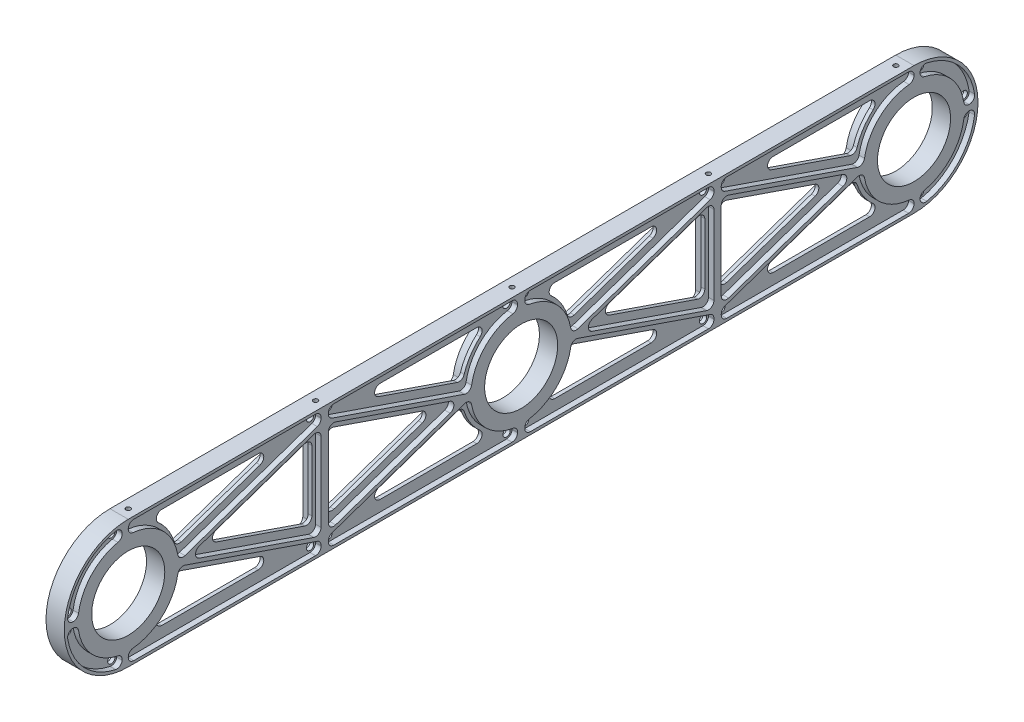
from build123d import *
from build123d.topology import SkipClean

# Parameters (mm, degrees)
SKETCH1_R                       = 35
BOSS_EXTRUDE1_DEPTH             = 10
SKETCH2_R                       = 20
CUT_EXTRUDE1_DEPTH              = 10
CUT_EXTRUDE2_DEPTH              = 10
CUT_EXTRUDE3_DEPTH              = 5
BOSS_EXTRUDE2_DEPTH             = 6
CUT_EXTRUDE4_START              = -3
CUT_EXTRUDE4_DEPTH              = 3
BOSS_EXTRUDE3_DEPTH             = 3
BOSS_EXTRUDE4_START             = -2
SKETCH10_R                      = 29.5
SKETCH10_R_2                    = 27.5
BOSS_EXTRUDE4_DEPTH             = 2
BOSS_EXTRUDE5_DEPTH             = 10
FILLET3_DEPTH                   = 10
FILLET3_START                   = 5
FILLET3_2_DEPTH                 = 2
FILLET3_3_DEPTH                 = 5
F_4_0MM_DOWEL_HOLE1_AT_2_COUNT  = 2
F_4_0MM_DOWEL_HOLE1_AT_2_PITCH  = 34.821054627
F_4_0MM_DOWEL_HOLE1_AT_3_COUNT  = 2
F_4_0MM_DOWEL_HOLE1_AT_3_PITCH  = 41.829541929
F_4_0MM_DOWEL_HOLE1_AT_4_COUNT  = 2
F_4_0MM_DOWEL_HOLE1_AT_4_PITCH  = 59.689414738
F_4_0MM_DOWEL_HOLE1_AT_5_COUNT  = 2
F_4_0MM_DOWEL_HOLE1_AT_5_PITCH  = 108.790331236
F_4_0MM_DOWEL_HOLE1_AT_6_COUNT  = 2
F_4_0MM_DOWEL_HOLE1_AT_6_PITCH  = 118.790165097
F_4_0MM_DOWEL_HOLE1_AT_7_COUNT  = 2
F_4_0MM_DOWEL_HOLE1_AT_7_PITCH  = 124.40414169
F_4_0MM_DOWEL_HOLE1_AT_8_COUNT  = 2
F_4_0MM_DOWEL_HOLE1_AT_8_PITCH  = 133.237223113
F_4_0MM_DOWEL_HOLE1_AT_9_COUNT  = 2
F_4_0MM_DOWEL_HOLE1_AT_9_PITCH  = 216.289350332
F_4_0MM_DOWEL_HOLE1_AT_10_COUNT = 2
F_4_0MM_DOWEL_HOLE1_AT_10_PITCH = 224.548741627
M3_TAPPED_HOLE1_AT_2_COUNT      = 2
M3_TAPPED_HOLE1_AT_2_PITCH      = 102.5
M3_TAPPED_HOLE1_AT_3_COUNT      = 2
M3_TAPPED_HOLE1_AT_3_PITCH      = 210
M3_TAPPED_HOLE1_AT_4_COUNT      = 2
M3_TAPPED_HOLE1_AT_4_PITCH      = 317.5
M3_TAPPED_HOLE1_AT_5_COUNT      = 2
M3_TAPPED_HOLE1_AT_5_PITCH      = 420


with BuildPart() as part:
    # Sketch1 → Boss-Extrude1 (new body)
    with BuildSketch(Plane(origin=(0, 0, 0), x_dir=(0, 0, -1), z_dir=(1, 0, 0))):
        with BuildLine():
            ThreePointArc((215, -35), (180, -2.5e-08), (214.99999995, 35))
            Line((214.99999995, 35), (-214.999999869, 35))
            ThreePointArc((-214.999999869, 35), (-190.251262612, 24.748737295), (-180, 0))
            ThreePointArc((-180, 0), (-190.251262658, -24.748737342), (-215, -35))
            Line((-215, -35), (215, -35))
        make_face()
        with Locations((215, 0)):
            Circle(SKETCH1_R)
        with Locations((-215, 0)):
            Circle(SKETCH1_R)
    extrude(amount=BOSS_EXTRUDE1_DEPTH)

    # Sketch2 → Cut-Extrude1 (cut)
    with BuildSketch(Plane.ZY):
        Circle(SKETCH2_R)
        with Locations((-215, 0)):
            Circle(SKETCH2_R)
        with Locations(Location((215, 0, 0), (0, 0, 180))):
            Circle(SKETCH2_R)
    extrude(amount=-CUT_EXTRUDE1_DEPTH, mode=Mode.SUBTRACT)

    # Sketch3 → Cut-Extrude2 (cut)
    with BuildSketch(Plane.ZY):
        with BuildLine():
            Line((-122.880840287, 27.5), (-215, 27.5))
            ThreePointArc((-215, 27.5), (-197.458599095, 21.178981427), (-187.981163347, 5.121763948))
            Line((-187.981163347, 5.121763948), (-122.880840287, 27.5))
        make_face()
        with BuildLine():
            ThreePointArc((-187.981163347, -5.121763948), (-197.458599095, -21.178981427), (-215, -27.5))
            Line((-215, -27.5), (-122.880840287, -27.5))
            Line((-122.880840287, -27.5), (-187.981163347, -5.121763948))
        make_face()
        with BuildLine():
            Line((-27.018836653, -5.121763948), (-92.119159713, -27.5))
            Line((-92.119159713, -27.5), (0, -27.5))
            ThreePointArc((0, -27.5), (-17.541400905, -21.178981427), (-27.018836653, -5.121763948))
        make_face()
        with BuildLine():
            Line((0, 27.5), (-92.119159713, 27.5))
            Line((-92.119159713, 27.5), (-27.018836653, 5.121763948))
            ThreePointArc((-27.018836653, 5.121763948), (-17.541400905, 21.178981427), (0, 27.5))
        make_face()
        Polygon((-103.5, 0), (-42.880840287, 0), (-103.5, 20.837836151), align=None)
        Polygon((-103.5, -20.837836151), (-42.880840287, 0), (-103.5, 0), align=None)
        Polygon((-111.5, 0), (-172.119159713, 0), (-111.5, -20.837836151), align=None)
        Polygon((-111.5, 20.837836151), (-172.119159713, 0), (-111.5, 0), align=None)
    cut_extrude2 = extrude(amount=-CUT_EXTRUDE2_DEPTH, mode=Mode.SUBTRACT)

    # Sketch5 → Cut-Extrude3 (cut)
    with BuildSketch(Plane.ZY):
        with BuildLine():
            Line((-92.119159713, -27.5), (-27.018836653, -5.121763948))
            ThreePointArc((-27.018836653, -5.121763948), (-27.5, 0), (-27.018836653, 5.121763948))
            Line((-27.018836653, 5.121763948), (-92.119159713, 27.5))
            Line((-92.119159713, 27.5), (0, 27.5))
            Line((0, 27.5), (0, 33.5))
            Line((0, 33.5), (-215, 33.5))
            ThreePointArc((-215, 33.5), (-248.5, 0), (-215, -33.5))
            Line((-215, -33.5), (0, -33.5))
            Line((0, -33.5), (0, -27.5))
            Line((0, -27.5), (-92.119159713, -27.5))
        make_face()
        with BuildLine():
            Line((-122.880840287, 27.5), (-187.981163347, 5.121763948))
            ThreePointArc((-187.981163347, 5.121763948), (-187.5, 0), (-187.981163347, -5.121763948))
            Line((-187.981163347, -5.121763948), (-122.880840287, -27.5))
            Line((-122.880840287, -27.5), (-215, -27.5))
            ThreePointArc((-215, -27.5), (-242.5, 0), (-215, 27.5))
            Line((-215, 27.5), (-122.880840287, 27.5))
        make_face(mode=Mode.SUBTRACT)
        Polygon((-103.5, -20.837836151), (-103.5, 20.837836151), (-42.880840287, 0), align=None, mode=Mode.SUBTRACT)
        Polygon((-172.119159713, 0), (-111.5, 20.837836151), (-111.5, -20.837836151), align=None, mode=Mode.SUBTRACT)
    cut_extrude3 = extrude(amount=-CUT_EXTRUDE3_DEPTH, mode=Mode.SUBTRACT)

    # Sketch4 → Boss-Extrude2 (add)
    with BuildSketch(Plane.ZY):
        with BuildLine():
            Line((-27.479926877, 1.050532634), (-105.499999999, 27.86993277))
            Line((-105.499999999, 27.86993277), (-105.499999999, 25.75506723))
            Line((-105.499999999, 25.75506723), (-30.576168057, 0))
            Line((-30.576168057, 0), (-105.499999999, -25.75506723))
            Line((-105.499999999, -25.75506723), (-105.499999999, -27.86993277))
            Line((-105.499999999, -27.86993277), (-27.479926877, -1.050532634))
            ThreePointArc((-27.479926877, -1.050532634), (-27.5, 0), (-27.479926877, 1.050532634))
        make_face()
        Polygon((-107.499999999, 28.55743277), (-105.499999999, 27.86993277), (-105.499999999, 33.5), (-109.499999999, 33.5), (-109.499999999, 27.86993277), align=None)
        Polygon((-105.499999999, 25.75506723), (-105.499999999, 27.86993277), (-107.499999999, 28.55743277), (-109.499999999, 27.86993277), (-109.499999999, 25.75506723), (-107.499999999, 26.44256723), align=None)
        Polygon((-109.499999999, 25.75506723), (-109.499999999, 27.86993277), (-190.576168056, 0), (-109.499999999, -27.86993277), (-109.499999999, -25.75506723), (-184.423831942, 0), align=None)
        Polygon((-105.499999999, -25.75506723), (-105.499999999, 25.75506723), (-107.499999999, 26.44256723), (-109.499999999, 25.75506723), (-109.499999999, -25.75506723), (-107.499999999, -26.44256723), align=None)
        Polygon((-105.499999999, -27.86993277), (-105.499999999, -25.75506723), (-107.499999999, -26.44256723), (-109.499999999, -25.75506723), (-109.499999999, -27.86993277), (-107.499999999, -28.55743277), align=None)
        Polygon((-105.499999999, -33.5), (-105.499999999, -27.86993277), (-107.499999999, -28.55743277), (-109.499999999, -27.86993277), (-109.499999999, -33.5), align=None)
        with BuildLine():
            Line((-214.999999999, 27.5), (-214.999999999, 33.5))
            ThreePointArc((-214.999999999, 33.5), (-216.827272726, 33.450128167), (-218.649104889, 33.300661157))
            Line((-218.649104889, 33.300661157), (-217.995533864, 27.336363636))
            ThreePointArc((-217.995533864, 27.336363636), (-216.499999999, 27.459060436), (-214.999999999, 27.5))
        make_face()
        with BuildLine():
            Line((-242.459060435, 1.5), (-248.46640106, 1.5))
            ThreePointArc((-248.46640106, 1.5), (-248.499999999, 0), (-248.46640106, -1.5))
            Line((-248.46640106, -1.5), (-242.459060435, -1.5))
            ThreePointArc((-242.459060435, -1.5), (-242.499999999, 0), (-242.459060435, 1.5))
        make_face()
        with BuildLine():
            ThreePointArc((-218.649104889, -33.300661157), (-216.827272726, -33.450128167), (-214.999999999, -33.5))
            Line((-214.999999999, -33.5), (-214.999999999, -27.5))
            ThreePointArc((-214.999999999, -27.5), (-216.499999999, -27.459060436), (-217.995533864, -27.336363636))
            Line((-217.995533864, -27.336363636), (-218.649104889, -33.300661157))
        make_face()
        Polygon((-204.999999999, 18.5), (-204.999999999, 33.5), (-214.999999999, 33.5), (-214.999999999, 27.5), align=None)
        Polygon((-214.999999999, -33.5), (-204.999999999, -33.5), (-204.999999999, -18.5), (-214.999999999, -27.5), align=None)
    boss_extrude2 = extrude(amount=-BOSS_EXTRUDE2_DEPTH)

    # Sketch6 → Cut-Extrude4 (cut)
    with SkipClean():  # the faces are left unmerged after this step: merging them gives an invalid solid
        with BuildSketch(Plane(origin=(10, 0, 0), x_dir=(0, 0, -1), z_dir=(1, 0, 0)).offset(CUT_EXTRUDE4_START)):
            with BuildLine():
                ThreePointArc((215, -33.5), (248.5, 0), (215, 33.5))
                Line((215, 33.5), (0, 33.5))
                Line((0, 33.5), (0, 27.5))
                Line((0, 27.5), (92.119159713, 27.5))
                Line((92.119159713, 27.5), (27.018836653, 5.121763948))
                ThreePointArc((27.018836653, 5.121763948), (27.5, 0), (27.018836653, -5.121763948))
                Line((27.018836653, -5.121763948), (92.119159713, -27.5))
                Line((92.119159713, -27.5), (0, -27.5))
                Line((0, -27.5), (0, -33.5))
                Line((0, -33.5), (215, -33.5))
            make_face()
            Polygon((103.5, -20.837836151), (42.880840287, 0), (103.5, 20.837836151), align=None, mode=Mode.SUBTRACT)
            Polygon((172.119159713, 0), (111.5, -20.837836151), (111.5, 20.837836151), align=None, mode=Mode.SUBTRACT)
            with BuildLine():
                Line((122.880840287, 27.5), (215, 27.5))
                ThreePointArc((215, 27.5), (242.5, 0), (215, -27.5))
                Line((215, -27.5), (122.880840287, -27.5))
                Line((122.880840287, -27.5), (187.981163347, -5.121763948))
                ThreePointArc((187.981163347, -5.121763948), (187.5, 0), (187.981163347, 5.121763948))
                Line((187.981163347, 5.121763948), (122.880840287, 27.5))
            make_face(mode=Mode.SUBTRACT)
        cut_extrude4 = extrude(amount=CUT_EXTRUDE4_DEPTH, mode=Mode.SUBTRACT)

    # Sketch7 → Boss-Extrude3 (add)
    with SkipClean():  # the faces are left unmerged after this step: merging them gives an invalid solid
        with BuildSketch(Plane(origin=(7, 0, -7), x_dir=(0, 0, 1), z_dir=(-1, 0, 0))):
            with BuildLine():
                Line((-20.479926877, 1.050532634), (-98.5, 27.86993277))
                Line((-98.5, 27.86993277), (-98.5, 25.75506723))
                Line((-98.5, 25.75506723), (-23.576168057, 0))
                Line((-23.576168057, 0), (-98.5, -25.75506723))
                Line((-98.5, -25.75506723), (-98.5, -27.86993277))
                Line((-98.5, -27.86993277), (-20.479926877, -1.050532634))
                ThreePointArc((-20.479926877, -1.050532634), (-20.5, 0), (-20.479926877, 1.050532634))
            make_face()
            Polygon((-100.5, 28.55743277), (-98.5, 27.86993277), (-98.5, 33.5), (-102.5, 33.5), (-102.5, 27.86993277), align=None)
            Polygon((-98.5, -25.75506723), (-98.5, 25.75506723), (-100.5, 26.44256723), (-102.5, 25.75506723), (-102.5, -25.75506723), (-100.5, -26.44256723), align=None)
            Polygon((-98.5, 25.75506723), (-98.5, 27.86993277), (-100.5, 28.55743277), (-102.5, 27.86993277), (-102.5, 25.75506723), (-100.5, 26.44256723), align=None)
            with BuildLine():
                Line((-102.5, 25.75506723), (-102.5, 27.86993277))
                Line((-102.5, 27.86993277), (-180.520073123, 1.050532634))
                ThreePointArc((-180.520073123, 1.050532634), (-180.5, 0), (-180.520073123, -1.050532634))
                Line((-180.520073123, -1.050532634), (-102.5, -27.86993277))
                Line((-102.5, -27.86993277), (-102.5, -25.75506723))
                Line((-102.5, -25.75506723), (-177.423831943, 0))
                Line((-177.423831943, 0), (-102.5, 25.75506723))
            make_face()
            Polygon((-98.5, -27.86993277), (-98.5, -25.75506723), (-100.5, -26.44256723), (-102.5, -25.75506723), (-102.5, -27.86993277), (-100.5, -28.55743277), align=None)
            with BuildLine():
                Line((-208, 27.5), (-208, 33.5))
                ThreePointArc((-208, 33.5), (-209.827272727, 33.450128167), (-211.649104891, 33.300661157))
                Line((-211.649104891, 33.300661157), (-210.995533866, 27.336363636))
                ThreePointArc((-210.995533866, 27.336363636), (-209.5, 27.459060435), (-208, 27.5))
            make_face()
            with BuildLine():
                Line((-235.459060435, 1.5), (-241.466401061, 1.5))
                ThreePointArc((-241.466401061, 1.5), (-241.5, 0), (-241.466401061, -1.5))
                Line((-241.466401061, -1.5), (-235.459060435, -1.5))
                ThreePointArc((-235.459060435, -1.5), (-235.5, 0), (-235.459060435, 1.5))
            make_face()
            with BuildLine():
                ThreePointArc((-211.649104891, -33.300661157), (-209.827272727, -33.450128167), (-208, -33.5))
                Line((-208, -33.5), (-208, -27.5))
                ThreePointArc((-208, -27.5), (-209.5, -27.459060435), (-210.995533866, -27.336363636))
                Line((-210.995533866, -27.336363636), (-211.649104891, -33.300661157))
            make_face()
            Polygon((-98.5, -33.5), (-98.5, -27.86993277), (-100.5, -28.55743277), (-102.5, -27.86993277), (-102.5, -33.5), align=None)
        boss_extrude3 = extrude(amount=-BOSS_EXTRUDE3_DEPTH)

    # Sketch10 → Boss-Extrude4 (add)
    # profile 1 of 3: a face of its own
    with BuildSketch(Plane(origin=(7, 0, 0), x_dir=(0, 0, -1), z_dir=(1, 0, 0)).offset(BOSS_EXTRUDE4_START)):
        with Locations((215, 0)):
            Circle(SKETCH10_R)
        with Locations((215, 0)):
            Circle(SKETCH10_R_2, mode=Mode.SUBTRACT)
    # profile 2 of 3: a face of its own
    with BuildSketch(Plane(origin=(7, 0, 0), x_dir=(0, 0, -1), z_dir=(1, 0, 0)).offset(BOSS_EXTRUDE4_START)):
        with BuildLine():
            Line((10.677078252, 27.5), (0, 27.5))
            ThreePointArc((0, 27.5), (17.541400905, 21.178981427), (27.018836653, 5.121763948))
            Line((27.018836653, 5.121763948), (28.928567421, 5.778233899))
            ThreePointArc((28.928567421, 5.778233899), (22.585627574, 18.977339832), (10.677078252, 27.5))
        make_face()
    # profile 3 of 3: a face of its own
    with BuildSketch(Plane(origin=(7, 0, 0), x_dir=(0, 0, -1), z_dir=(1, 0, 0)).offset(BOSS_EXTRUDE4_START)):
        with BuildLine():
            ThreePointArc((27.479926877, 1.050532634), (27.494981261, 0.525362195), (27.5, 0))
            ThreePointArc((27.5, 0), (-19.445436483, -19.445436483), (0, 27.5))
            Line((0, 27.5), (0, 29.5))
            ThreePointArc((0, 29.5), (-20.859650045, -20.859650045), (29.5, 0))
            ThreePointArc((29.5, 0), (29.487340829, 0.864135894), (29.44937418, 1.727530144))
            Line((29.44937418, 1.727530144), (27.479926877, 1.050532634))
        make_face()
    boss_extrude4 = extrude(amount=BOSS_EXTRUDE4_DEPTH)

    # Sketch11 → Boss-Extrude5 (add)
    with BuildSketch(Plane(origin=(10, 0, 0), x_dir=(0, 0, -1), z_dir=(1, 0, 0))):
        Polygon((0, 33.5), (0, 27.5), (2, 27.427176304), (2, 33.5), align=None)
        Polygon((2, -33.5), (0, -33.5), (0, -27.5), (2, -27.427176304), align=None)
    boss_extrude5 = extrude(amount=-BOSS_EXTRUDE5_DEPTH)

    # Fillet3: read off the stored shape, not the designer's step
    # Fillet3 outline → Fillet3 (add)
    with BuildSketch(Plane.YZ):
        with BuildLine():
            Line((-33.5, -109.5), (-33.5, -112.5))
            ThreePointArc((-33.5, -112.5), (-32.621320344, -110.378679656), (-30.5, -109.5))
            Line((-30.5, -109.5), (-33.5, -109.5))
        make_face()
        with BuildLine():
            ThreePointArc((-30.5, -215), (-32.621320344, -214.121320344), (-33.5, -212))
            Line((-33.5, -212), (-33.5, -215))
            Line((-33.5, -215), (-30.5, -215))
        make_face()
        with BuildLine():
            Line((-27.86993277, -109.499999999), (-30.010981079, -109.5))
            ThreePointArc((-30.010981079, -109.5), (-28.268241557, -110.05810341), (-27.173921281, -111.524760694))
            Line((-27.173921281, -111.524760694), (-27.86993277, -109.499999999))
        make_face()
        with BuildLine():
            ThreePointArc((-2.275572027, -183.956322161), (-2.53280372, -186.462733224), (-4.609750006, -187.889112798))
            ThreePointArc((-4.609750006, -187.889112798), (-2.836150113, -187.646640928), (-1.050532634, -187.520073123))
            Line((-1.050532634, -187.520073123), (-2.275572027, -183.956322161))
        make_face()
        with BuildLine():
            ThreePointArc((-27.5, -215), (-27.466641748, -213.645898421), (-27.366647921, -212.295081967))
            ThreePointArc((-27.366647921, -212.295081967), (-28.337807233, -214.223201059), (-30.352100422, -215))
            Line((-30.352100422, -215), (-27.5, -215))
        make_face()
        with BuildLine():
            ThreePointArc((30.5, -109.5), (32.621320344, -110.378679656), (33.5, -112.5))
            Line((33.5, -112.5), (33.5, -109.5))
            Line((33.5, -109.5), (30.5, -109.5))
        make_face()
        with BuildLine():
            Line((33.5, -215), (33.5, -212))
            ThreePointArc((33.5, -212), (32.621320344, -214.121320344), (30.5, -215))
            Line((30.5, -215), (33.5, -215))
        make_face()
        with BuildLine():
            ThreePointArc((1.050532633, -187.520073123), (2.836150112, -187.646640928), (4.609750006, -187.889112798))
            ThreePointArc((4.609750006, -187.889112798), (2.53280372, -186.462733224), (2.275572027, -183.956322161))
            Line((2.275572027, -183.956322161), (1.050532633, -187.520073123))
        make_face()
        with BuildLine():
            ThreePointArc((30.352100422, -215), (28.337807233, -214.223201059), (27.366647921, -212.295081967))
            ThreePointArc((27.366647921, -212.295081967), (27.466641748, -213.645898421), (27.5, -215))
            Line((27.5, -215), (30.352100422, -215))
        make_face()
        with BuildLine():
            ThreePointArc((27.173921281, -111.524760694), (28.268241557, -110.05810341), (30.010981079, -109.5))
            Line((30.010981079, -109.5), (27.86993277, -109.499999999))
            Line((27.86993277, -109.499999999), (27.173921281, -111.524760694))
        make_face()
        with BuildLine():
            ThreePointArc((-1.5, -245.166206258), (-2.541412352, -247.438635449), (-4.942622951, -248.133374087))
            ThreePointArc((-4.942622951, -248.133374087), (-3.225612246, -248.344346232), (-1.5, -248.466401061))
            Line((-1.5, -248.466401061), (-1.5, -245.166206258))
        make_face()
        with BuildLine():
            ThreePointArc((-4.057377049, -242.199038429), (-2.227570809, -243.20761861), (-1.5, -245.166206258))
            Line((-1.5, -245.166206258), (-1.5, -242.459060435))
            ThreePointArc((-1.5, -242.459060435), (-2.781728379, -242.358947114), (-4.057377049, -242.199038429))
        make_face()
        with BuildLine():
            ThreePointArc((-33.300661157, -218.649104891), (-33.08058441, -220.284404894), (-32.780252357, -221.906884641))
            ThreePointArc((-32.780252357, -221.906884641), (-32.274093408, -219.528220313), (-30.171492882, -218.306208898))
            Line((-30.171492882, -218.306208898), (-33.300661157, -218.649104891))
        make_face()
        with BuildLine():
            Line((-27.336363636, -217.995533866), (-30.171492882, -218.306208898))
            ThreePointArc((-30.171492882, -218.306208898), (-28.084570024, -218.85897162), (-26.909162382, -220.669830676))
            ThreePointArc((-26.909162382, -220.669830676), (-27.15570362, -219.337944316), (-27.336363636, -217.995533866))
        make_face()
        with BuildLine():
            Line((25.75506723, -105.499999999), (24.388578719, -101.524760694))
            ThreePointArc((24.388578719, -101.524760694), (23.993415511, -104.242739522), (21.551518921, -105.5))
            Line((21.551518921, -105.5), (25.75506723, -105.499999999))
        make_face()
        with BuildLine():
            ThreePointArc((-2.837059798, -38.829432924), (0, -36.80467223), (2.837059798, -38.829432924))
            Line((2.837059798, -38.829432924), (0, -30.576168057))
            Line((0, -30.576168057), (-2.837059798, -38.829432924))
        make_face()
        with BuildLine():
            Line((-25.75506723, -105.499999999), (-21.551518921, -105.5))
            ThreePointArc((-21.551518921, -105.5), (-23.993415511, -104.242739522), (-24.388578719, -101.524760694))
            Line((-24.388578719, -101.524760694), (-25.75506723, -105.499999999))
        make_face()
        with BuildLine():
            Line((25.75506723, -109.499999999), (21.551518921, -109.5))
            ThreePointArc((21.551518921, -109.5), (23.993415511, -110.757260478), (24.388578719, -113.475239306))
            Line((24.388578719, -113.475239306), (25.75506723, -109.499999999))
        make_face()
        with BuildLine():
            ThreePointArc((-24.388578719, -113.475239306), (-23.993415511, -110.757260478), (-21.551518921, -109.5))
            Line((-21.551518921, -109.5), (-25.75506723, -109.499999999))
            Line((-25.75506723, -109.499999999), (-24.388578719, -113.475239306))
        make_face()
        with BuildLine():
            Line((0, -184.423831942), (2.837059798, -176.170567076))
            ThreePointArc((2.837059798, -176.170567076), (0, -178.19532777), (-2.837059798, -176.170567076))
            Line((-2.837059798, -176.170567076), (0, -184.423831942))
        make_face()
        with BuildLine():
            ThreePointArc((27.427176304, -2), (27.306381326, -3.257535707), (27.127959052, -4.508196721))
            ThreePointArc((27.127959052, -4.508196721), (28.147709115, -2.711396732), (30.087372767, -2))
            Line((30.087372767, -2), (27.427176304, -2))
        make_face()
        with BuildLine():
            ThreePointArc((2.275572027, -31.043677839), (2.53280372, -28.537266776), (4.609750006, -27.110887202))
            ThreePointArc((4.609750006, -27.110887202), (2.836150113, -27.353359072), (1.050532634, -27.479926877))
            Line((1.050532634, -27.479926877), (2.275572027, -31.043677839))
        make_face()
        with BuildLine():
            Line((33.5, -2), (30.5, -2))
            ThreePointArc((30.5, -2), (32.621320344, -2.878679656), (33.5, -5))
            Line((33.5, -5), (33.5, -2))
        make_face()
        with BuildLine():
            ThreePointArc((30.010981079, -105.5), (28.268241557, -104.94189659), (27.173921281, -103.475239306))
            Line((27.173921281, -103.475239306), (27.86993277, -105.499999999))
            Line((27.86993277, -105.499999999), (30.010981079, -105.5))
        make_face()
        with BuildLine():
            Line((33.5, -105.499999999), (33.5, -102.5))
            ThreePointArc((33.5, -102.5), (32.621320344, -104.621320344), (30.5, -105.5))
            Line((30.5, -105.5), (33.5, -105.499999999))
        make_face()
        with BuildLine():
            Line((-27.427176304, -2), (-30.087372767, -2))
            ThreePointArc((-30.087372767, -2), (-28.147709115, -2.711396732), (-27.127959052, -4.508196721))
            ThreePointArc((-27.127959052, -4.508196721), (-27.306381326, -3.257535707), (-27.427176304, -2))
        make_face()
        with BuildLine():
            ThreePointArc((-33.5, -5), (-32.621320344, -2.878679656), (-30.5, -2))
            Line((-30.5, -2), (-33.5, -2))
            Line((-33.5, -2), (-33.5, -5))
        make_face()
        with BuildLine():
            ThreePointArc((-1.050532634, -27.479926877), (-2.836150113, -27.353359072), (-4.609750006, -27.110887202))
            ThreePointArc((-4.609750006, -27.110887202), (-2.53280372, -28.537266776), (-2.275572027, -31.043677839))
            Line((-2.275572027, -31.043677839), (-1.050532634, -27.479926877))
        make_face()
        with BuildLine():
            ThreePointArc((-30.5, -105.5), (-32.621320344, -104.621320344), (-33.5, -102.5))
            Line((-33.5, -102.5), (-33.5, -105.5))
            Line((-33.5, -105.5), (-30.5, -105.5))
        make_face()
        with BuildLine():
            Line((-27.86993277, -105.499999999), (-27.173921281, -103.475239306))
            ThreePointArc((-27.173921281, -103.475239306), (-28.268241557, -104.94189659), (-30.010981079, -105.5))
            Line((-30.010981079, -105.5), (-27.86993277, -105.499999999))
        make_face()
        with BuildLine():
            Line((1.5, -242.459060435), (1.5, -245.166206258))
            ThreePointArc((1.5, -245.166206258), (2.227570809, -243.20761861), (4.057377049, -242.199038429))
            ThreePointArc((4.057377049, -242.199038429), (2.781728379, -242.358947114), (1.5, -242.459060435))
        make_face()
        with BuildLine():
            ThreePointArc((4.942622951, -248.133374087), (2.541412352, -247.438635449), (1.5, -245.166206258))
            Line((1.5, -245.166206258), (1.5, -248.466401061))
            ThreePointArc((1.5, -248.466401061), (3.225612246, -248.344346232), (4.942622951, -248.133374087))
        make_face()
        with BuildLine():
            ThreePointArc((30.171492882, -218.306208898), (32.274093408, -219.528220313), (32.780252356, -221.906884642))
            ThreePointArc((32.780252356, -221.906884642), (33.08058441, -220.284404893), (33.300661157, -218.649104889))
            Line((33.300661157, -218.649104889), (30.171492882, -218.306208898))
        make_face()
        with BuildLine():
            ThreePointArc((27.336363637, -217.995533864), (27.155703621, -219.337944315), (26.909162383, -220.669830676))
            ThreePointArc((26.909162383, -220.669830676), (28.084570024, -218.85897162), (30.171492882, -218.306208898))
            Line((30.171492882, -218.306208898), (27.336363637, -217.995533864))
        make_face()
    fillet3 = extrude(amount=FILLET3_DEPTH)

    # Fillet3 2 outline → Fillet3 2 (add)
    with BuildSketch(Plane.YZ.offset(FILLET3_START)):
        with BuildLine():
            ThreePointArc((-19.47134764, -115.475239306), (-19.076184433, -112.757260478), (-16.634287842, -111.5))
            Line((-16.634287842, -111.5), (-20.837836151, -111.5))
            Line((-20.837836151, -111.5), (-19.47134764, -115.475239306))
        make_face()
        with BuildLine():
            Line((20.837836151, -111.5), (16.634287842, -111.5))
            ThreePointArc((16.634287842, -111.5), (19.076184433, -112.757260478), (19.47134764, -115.475239306))
            Line((19.47134764, -115.475239306), (20.837836151, -111.5))
        make_face()
        with BuildLine():
            ThreePointArc((2.837059798, -163.865894846), (0, -165.890655541), (-2.837059798, -163.865894846))
            Line((-2.837059798, -163.865894846), (0, -172.119159713))
            Line((0, -172.119159713), (2.837059798, -163.865894846))
        make_face()
        with BuildLine():
            Line((-20.837836151, -103.5), (-16.634287842, -103.5))
            ThreePointArc((-16.634287842, -103.5), (-19.076184433, -102.242739522), (-19.47134764, -99.524760694))
            Line((-19.47134764, -99.524760694), (-20.837836151, -103.5))
        make_face()
        with BuildLine():
            ThreePointArc((19.47134764, -99.524760694), (19.076184433, -102.242739522), (16.634287842, -103.5))
            Line((16.634287842, -103.5), (20.837836151, -103.5))
            Line((20.837836151, -103.5), (19.47134764, -99.524760694))
        make_face()
        with BuildLine():
            Line((0, -42.880840287), (-2.837059798, -51.134105154))
            ThreePointArc((-2.837059798, -51.134105154), (0, -49.109344459), (2.837059798, -51.134105154))
            Line((2.837059798, -51.134105154), (0, -42.880840287))
        make_face()
        with BuildLine():
            ThreePointArc((8.779217856, -186.836631348), (6.995633383, -185.327903619), (6.834959874, -182.997320654))
            Line((6.834959874, -182.997320654), (5.778233899, -186.071432579))
            ThreePointArc((5.778233899, -186.071432579), (7.28877443, -186.414623191), (8.779217856, -186.836631348))
        make_face()
        with BuildLine():
            Line((27.5, -122.880840287), (21.662940202, -139.861377881))
            ThreePointArc((21.662940202, -139.861377881), (24.994378704, -137.877632615), (27.5, -140.836617186))
            Line((27.5, -140.836617186), (27.5, -122.880840287))
        make_face()
        with BuildLine():
            ThreePointArc((27.5, -193.645843496), (25.552469623, -196.455168627), (22.238461538, -195.616996404))
            ThreePointArc((22.238461538, -195.616996404), (25.247315166, -199.741458886), (27.5, -204.322921748))
            Line((27.5, -204.322921748), (27.5, -193.645843496))
        make_face()
        with BuildLine():
            ThreePointArc((-8.779217856, -28.163368652), (-6.995633383, -29.672096381), (-6.834959874, -32.002679346))
            Line((-6.834959874, -32.002679346), (-5.778233899, -28.928567421))
            ThreePointArc((-5.778233899, -28.928567421), (-7.28877443, -28.585376809), (-8.779217856, -28.163368652))
        make_face()
        with BuildLine():
            Line((-27.5, -92.119159713), (-21.662940202, -75.138622119))
            ThreePointArc((-21.662940202, -75.138622119), (-24.994378704, -77.122367385), (-27.5, -74.163382814))
            Line((-27.5, -74.163382814), (-27.5, -92.119159713))
        make_face()
        with BuildLine():
            ThreePointArc((-27.5, -21.354156504), (-25.552469623, -18.544831373), (-22.238461538, -19.383003596))
            ThreePointArc((-22.238461538, -19.383003596), (-25.247315166, -15.258541114), (-27.5, -10.677078252))
            Line((-27.5, -10.677078252), (-27.5, -21.354156504))
        make_face()
        with BuildLine():
            ThreePointArc((-22.238461538, -195.616996404), (-25.552469623, -196.455168627), (-27.5, -193.645843496))
            Line((-27.5, -193.645843496), (-27.5, -204.322921748))
            ThreePointArc((-27.5, -204.322921748), (-25.247315166, -199.741458886), (-22.238461538, -195.616996404))
        make_face()
        with BuildLine():
            Line((-27.5, -122.880840287), (-27.5, -140.836617186))
            ThreePointArc((-27.5, -140.836617186), (-24.994378704, -137.877632615), (-21.662940202, -139.861377881))
            Line((-21.662940202, -139.861377881), (-27.5, -122.880840287))
        make_face()
        with BuildLine():
            ThreePointArc((-6.834959874, -182.997320654), (-6.995633383, -185.327903619), (-8.779217856, -186.836631348))
            ThreePointArc((-8.779217856, -186.836631348), (-7.28877443, -186.414623191), (-5.778233899, -186.071432579))
            Line((-5.778233899, -186.071432579), (-6.834959874, -182.997320654))
        make_face()
        with BuildLine():
            ThreePointArc((27.5, -74.163382814), (24.994378704, -77.122367385), (21.662940202, -75.138622119))
            Line((21.662940202, -75.138622119), (27.5, -92.119159713))
            Line((27.5, -92.119159713), (27.5, -74.163382814))
        make_face()
        with BuildLine():
            Line((5.778233899, -28.928567421), (6.834959874, -32.002679346))
            ThreePointArc((6.834959874, -32.002679346), (6.995633383, -29.672096381), (8.779217856, -28.163368652))
            ThreePointArc((8.779217856, -28.163368652), (7.28877443, -28.585376809), (5.778233899, -28.928567421))
        make_face()
        with BuildLine():
            ThreePointArc((22.238461538, -19.383003596), (25.552469623, -18.544831373), (27.5, -21.354156504))
            Line((27.5, -21.354156504), (27.5, -10.677078252))
            ThreePointArc((27.5, -10.677078252), (25.247315166, -15.258541114), (22.238461538, -19.383003596))
        make_face()
    fillet3_2 = extrude(amount=FILLET3_2_DEPTH)

    # Fillet3 3 outline → Fillet3 3 (add)
    with BuildSketch(Plane.YZ):
        with BuildLine():
            ThreePointArc((-30.5, -204.999999999), (-32.621320344, -204.121320343), (-33.5, -201.999999999))
            Line((-33.5, -201.999999999), (-33.5, -204.999999999))
            Line((-33.5, -204.999999999), (-30.5, -204.999999999))
        make_face()
        with BuildLine():
            ThreePointArc((-24.876914143, -203.278688524), (-25.983909232, -204.533383663), (-27.590759322, -204.999999999))
            Line((-27.590759322, -204.999999999), (-25.617376915, -204.999999999))
            ThreePointArc((-25.617376915, -204.999999999), (-25.261810815, -204.133035642), (-24.876914143, -203.278688524))
        make_face()
        with BuildLine():
            ThreePointArc((33.5, -201.999999999), (32.621320344, -204.121320343), (30.5, -204.999999999))
            Line((30.5, -204.999999999), (33.5, -204.999999999))
            Line((33.5, -204.999999999), (33.5, -201.999999999))
        make_face()
        with BuildLine():
            Line((25.617376915, -204.999999999), (27.590759322, -204.999999999))
            ThreePointArc((27.590759322, -204.999999999), (25.983909232, -204.533383663), (24.876914143, -203.278688524))
            ThreePointArc((24.876914143, -203.278688524), (25.261810815, -204.133035642), (25.617376915, -204.999999999))
        make_face()
    fillet3_3 = extrude(amount=FILLET3_3_DEPTH)

    # Sketch12 → Ø4.0mm Dowel Hole1 (revolve, cut)
    with BuildSketch(Plane(origin=(7, 29.844707369, -221.288357659), x_dir=(0, 0, -1), z_dir=(0, 1, 0))):
        Polygon((0, 0), (0, 18.491721238), (2, 17.29), (2, 0), align=None)
    f_4_0mm_dowel_hole1 = revolve(axis=Axis((13.35, 29.844707369, -221.288357659), (-1, 0, 0)), mode=Mode.SUBTRACT)

    # Ø4.0mm Dowel Hole1 at 2: Ø4.0mm Dowel Hole1 ×2
    with Locations(*[Vector(0, -0.7278558228775854, -0.6857301955603187) * (i * F_4_0MM_DOWEL_HOLE1_AT_2_PITCH) for i in range(1, F_4_0MM_DOWEL_HOLE1_AT_2_COUNT)]):
        add(f_4_0mm_dowel_hole1, mode=Mode.SUBTRACT)

    # Ø4.0mm Dowel Hole1 at 3: Ø4.0mm Dowel Hole1 ×2
    with Locations(*[Vector(0, -0.8210634347223147, -0.570836961103602) * (i * F_4_0MM_DOWEL_HOLE1_AT_3_PITCH) for i in range(1, F_4_0MM_DOWEL_HOLE1_AT_3_COUNT)]):
        add(f_4_0mm_dowel_hole1, mode=Mode.SUBTRACT)

    # Ø4.0mm Dowel Hole1 at 4: Ø4.0mm Dowel Hole1 ×2
    with Locations(*[(0, -i * F_4_0MM_DOWEL_HOLE1_AT_4_PITCH, 0) for i in range(1, F_4_0MM_DOWEL_HOLE1_AT_4_COUNT)]):
        add(f_4_0mm_dowel_hole1, mode=Mode.SUBTRACT)

    # Ø4.0mm Dowel Hole1 at 5: Ø4.0mm Dowel Hole1 ×2
    with Locations(*[Vector(0, 0.006023445496666668, 0.9999818588876244) * (i * F_4_0MM_DOWEL_HOLE1_AT_5_PITCH) for i in range(1, F_4_0MM_DOWEL_HOLE1_AT_5_COUNT)]):
        add(f_4_0mm_dowel_hole1, mode=Mode.SUBTRACT)

    # Ø4.0mm Dowel Hole1 at 6: Ø4.0mm Dowel Hole1 ×2
    with Locations(*[Vector(0, 0.005516387911687325, 0.99998478461645) * (i * F_4_0MM_DOWEL_HOLE1_AT_6_PITCH) for i in range(1, F_4_0MM_DOWEL_HOLE1_AT_6_COUNT)]):
        add(f_4_0mm_dowel_hole1, mode=Mode.SUBTRACT)

    # Ø4.0mm Dowel Hole1 at 7: Ø4.0mm Dowel Hole1 ×2
    with Locations(*[Vector(0, -0.48506992250872033, 0.8744753685938697) * (i * F_4_0MM_DOWEL_HOLE1_AT_7_PITCH) for i in range(1, F_4_0MM_DOWEL_HOLE1_AT_7_COUNT)]):
        add(f_4_0mm_dowel_hole1, mode=Mode.SUBTRACT)

    # Ø4.0mm Dowel Hole1 at 8: Ø4.0mm Dowel Hole1 ×2
    with Locations(*[Vector(0, -0.45291177615016626, 0.8915553392944836) * (i * F_4_0MM_DOWEL_HOLE1_AT_8_PITCH) for i in range(1, F_4_0MM_DOWEL_HOLE1_AT_8_COUNT)]):
        add(f_4_0mm_dowel_hole1, mode=Mode.SUBTRACT)

    # Ø4.0mm Dowel Hole1 at 9: Ø4.0mm Dowel Hole1 ×2
    with Locations(*[Vector(0, 0.00302970363432165, 0.9999954104374121) * (i * F_4_0MM_DOWEL_HOLE1_AT_9_PITCH) for i in range(1, F_4_0MM_DOWEL_HOLE1_AT_9_COUNT)]):
        add(f_4_0mm_dowel_hole1, mode=Mode.SUBTRACT)

    # Ø4.0mm Dowel Hole1 at 10: Ø4.0mm Dowel Hole1 ×2
    with Locations(*[Vector(0, -0.2687376777622079, 0.9632134034319579) * (i * F_4_0MM_DOWEL_HOLE1_AT_10_PITCH) for i in range(1, F_4_0MM_DOWEL_HOLE1_AT_10_COUNT)]):
        add(f_4_0mm_dowel_hole1, mode=Mode.SUBTRACT)

    # Mirror8: Cut-Extrude2, Cut-Extrude3, Boss-Extrude2, Cut-Extrude4, Boss-Extrude3, Boss-Extrude4, Boss-Extrude5, Fillet3, Fillet3 2, Fillet3 3, Ø4.0mm Dowel Hole1 across plane
    with SkipClean():  # the faces are left unmerged after this step: merging them gives an invalid solid
        add(cut_extrude2.mirror(Plane.XY), mode=Mode.SUBTRACT)
        add(cut_extrude3.mirror(Plane.XY), mode=Mode.SUBTRACT)
        add(boss_extrude2.mirror(Plane.XY))
        add(cut_extrude4.mirror(Plane.XY), mode=Mode.SUBTRACT)
        add(boss_extrude3.mirror(Plane.XY))
        add(boss_extrude4.mirror(Plane.XY))
        add(boss_extrude5.mirror(Plane.XY))
        add(fillet3.mirror(Plane.XY))
        add(fillet3_2.mirror(Plane.XY))
        add(fillet3_3.mirror(Plane.XY))
        add(f_4_0mm_dowel_hole1.mirror(Plane.XY), mode=Mode.SUBTRACT)

    # Mirror8 copy 1 sketch → Mirror8 copy 1 (revolve, cut)
    with BuildSketch(Plane(origin=(7, 4.5, 245.166206258), x_dir=(0, 0, 1), z_dir=(0, 1, 0))):
        Polygon((0, 0), (0, -18.491721238), (2, -17.29), (2, 0), align=None)
    revolve(axis=Axis((13.35, 4.5, 245.166206258), (1, 0, 0)), mode=Mode.SUBTRACT)

    # Mirror8 copy 2 sketch → Mirror8 copy 2 (revolve, cut)
    with BuildSketch(Plane(origin=(7, -4.5, 245.166206258), x_dir=(0, 0, 1), z_dir=(0, 1, 0))):
        Polygon((0, 0), (0, -18.491721238), (2, -17.29), (2, 0), align=None)
    revolve(axis=Axis((13.35, -4.5, 245.166206258), (1, 0, 0)), mode=Mode.SUBTRACT)

    # Mirror8 copy 3 sketch → Mirror8 copy 3 (revolve, cut)
    with BuildSketch(Plane(origin=(7, -29.844707369, 221.288357659), x_dir=(0, 0, 1), z_dir=(0, 1, 0))):
        Polygon((0, 0), (0, -18.491721238), (2, -17.29), (2, 0), align=None)
    revolve(axis=Axis((13.35, -29.844707369, 221.288357659), (1, 0, 0)), mode=Mode.SUBTRACT)

    # Mirror8 copy 4 sketch → Mirror8 copy 4 (revolve, cut)
    with BuildSketch(Plane(origin=(7, 30.5, 112.5), x_dir=(0, 0, 1), z_dir=(0, 1, 0))):
        Polygon((0, 0), (0, -18.491721238), (2, -17.29), (2, 0), align=None)
    revolve(axis=Axis((13.35, 30.5, 112.5), (1, 0, 0)), mode=Mode.SUBTRACT)

    # Mirror8 copy 5 sketch → Mirror8 copy 5 (revolve, cut)
    with BuildSketch(Plane(origin=(7, 30.5, 102.5), x_dir=(0, 0, 1), z_dir=(0, 1, 0))):
        Polygon((0, 0), (0, -18.491721238), (2, -17.29), (2, 0), align=None)
    revolve(axis=Axis((13.35, 30.5, 102.5), (1, 0, 0)), mode=Mode.SUBTRACT)

    # Mirror8 copy 6 sketch → Mirror8 copy 6 (revolve, cut)
    with BuildSketch(Plane(origin=(7, -30.5, 112.5), x_dir=(0, 0, 1), z_dir=(0, 1, 0))):
        Polygon((0, 0), (0, -18.491721238), (2, -17.29), (2, 0), align=None)
    revolve(axis=Axis((13.35, -30.5, 112.5), (1, 0, 0)), mode=Mode.SUBTRACT)

    # Mirror8 copy 7 sketch → Mirror8 copy 7 (revolve, cut)
    with BuildSketch(Plane(origin=(7, -30.5, 102.5), x_dir=(0, 0, 1), z_dir=(0, 1, 0))):
        Polygon((0, 0), (0, -18.491721238), (2, -17.29), (2, 0), align=None)
    revolve(axis=Axis((13.35, -30.5, 102.5), (1, 0, 0)), mode=Mode.SUBTRACT)

    # Mirror8 copy 8 sketch → Mirror8 copy 8 (revolve, cut)
    with BuildSketch(Plane(origin=(7, 30.5, 5), x_dir=(0, 0, 1), z_dir=(0, 1, 0))):
        Polygon((0, 0), (0, -18.491721238), (2, -17.29), (2, 0), align=None)
    revolve(axis=Axis((13.35, 30.5, 5), (1, 0, 0)), mode=Mode.SUBTRACT)

    # Mirror8 copy 9 sketch → Mirror8 copy 9 (revolve, cut)
    with BuildSketch(Plane(origin=(7, -30.5, 5), x_dir=(0, 0, 1), z_dir=(0, 1, 0))):
        Polygon((0, 0), (0, -18.491721238), (2, -17.29), (2, 0), align=None)
    revolve(axis=Axis((13.35, -30.5, 5), (1, 0, 0)), mode=Mode.SUBTRACT)

    # Sketch15 → M3 Tapped Hole1 (revolve, cut)
    with BuildSketch(Plane(origin=(5, 35, 210), x_dir=(0, 0, 1), z_dir=(1, 0, 0))):
        Polygon((0, 0), (0, 8.251075774), (1.25, 7.5), (1.25, 0), align=None)
    m3_tapped_hole1 = revolve(axis=Axis((5, 41.35, 210), (0, -1, 0)), mode=Mode.SUBTRACT)

    # M3 Tapped Hole1 at 2: M3 Tapped Hole1 ×2
    with Locations(*[(0, 0, -i * M3_TAPPED_HOLE1_AT_2_PITCH) for i in range(1, M3_TAPPED_HOLE1_AT_2_COUNT)]):
        add(m3_tapped_hole1, mode=Mode.SUBTRACT)

    # M3 Tapped Hole1 at 3: M3 Tapped Hole1 ×2
    with Locations(*[(0, 0, -i * M3_TAPPED_HOLE1_AT_3_PITCH) for i in range(1, M3_TAPPED_HOLE1_AT_3_COUNT)]):
        add(m3_tapped_hole1, mode=Mode.SUBTRACT)

    # M3 Tapped Hole1 at 4: M3 Tapped Hole1 ×2
    with Locations(*[(0, 0, -i * M3_TAPPED_HOLE1_AT_4_PITCH) for i in range(1, M3_TAPPED_HOLE1_AT_4_COUNT)]):
        add(m3_tapped_hole1, mode=Mode.SUBTRACT)

    # M3 Tapped Hole1 at 5: M3 Tapped Hole1 ×2
    with Locations(*[(0, 0, -i * M3_TAPPED_HOLE1_AT_5_PITCH) for i in range(1, M3_TAPPED_HOLE1_AT_5_COUNT)]):
        add(m3_tapped_hole1, mode=Mode.SUBTRACT)

    # Mirror9: M3 Tapped Hole1 across plane
    add(m3_tapped_hole1.mirror(Plane.ZX), mode=Mode.SUBTRACT)

    # Mirror9 copy 1 sketch → Mirror9 copy 1 (revolve, cut)
    with BuildSketch(Plane(origin=(5, -35, 107.5), x_dir=(0, 0, 1), z_dir=(1, 0, 0))):
        Polygon((0, 0), (0, -8.251075774), (1.25, -7.5), (1.25, 0), align=None)
    revolve(axis=Axis((5, -41.35, 107.5), (0, -1, 0)), mode=Mode.SUBTRACT)

    # Mirror9 copy 2 sketch → Mirror9 copy 2 (revolve, cut)
    with BuildSketch(Plane(origin=(5, -35, 0), x_dir=(0, 0, 1), z_dir=(1, 0, 0))):
        Polygon((0, 0), (0, -8.251075774), (1.25, -7.5), (1.25, 0), align=None)
    revolve(axis=Axis((5, -41.35, 0), (0, -1, 0)), mode=Mode.SUBTRACT)

    # Mirror9 copy 3 sketch → Mirror9 copy 3 (revolve, cut)
    with BuildSketch(Plane(origin=(5, -35, -107.5), x_dir=(0, 0, 1), z_dir=(1, 0, 0))):
        Polygon((0, 0), (0, -8.251075774), (1.25, -7.5), (1.25, 0), align=None)
    revolve(axis=Axis((5, -41.35, -107.5), (0, -1, 0)), mode=Mode.SUBTRACT)

    # Mirror9 copy 4 sketch → Mirror9 copy 4 (revolve, cut)
    with BuildSketch(Plane(origin=(5, -35, -210), x_dir=(0, 0, 1), z_dir=(1, 0, 0))):
        Polygon((0, 0), (0, -8.251075774), (1.25, -7.5), (1.25, 0), align=None)
    revolve(axis=Axis((5, -41.35, -210), (0, -1, 0)), mode=Mode.SUBTRACT)


solid = part.part
